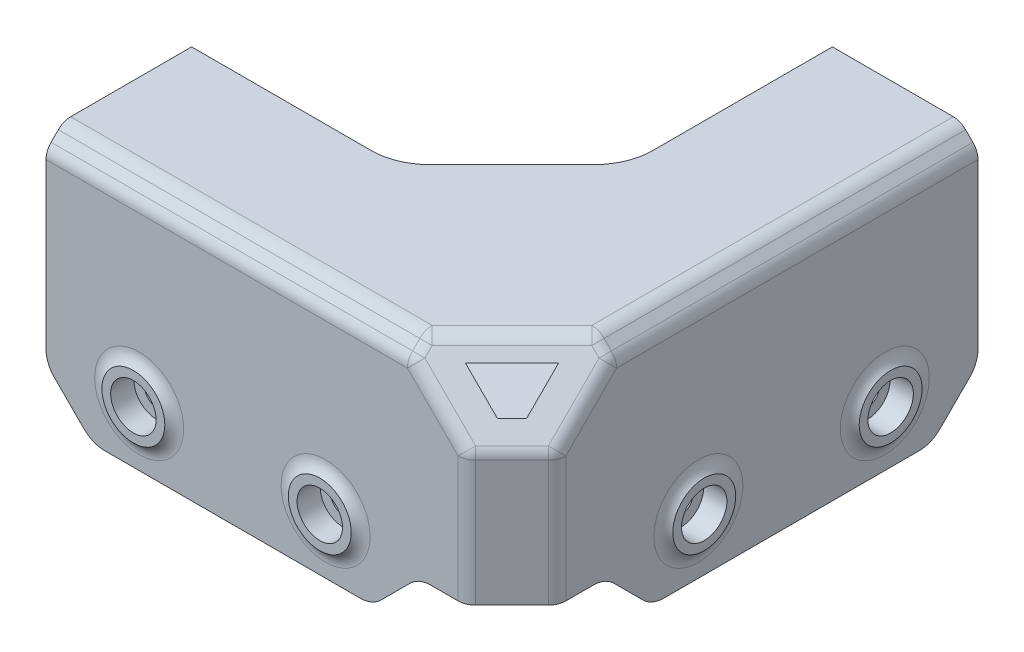
from build123d import *

# Parameters (mm, degrees)
BOSS_EXTRUDE1_DEPTH = 2
BOSS_EXTRUDE2_DEPTH = 20
BOSS_EXTRUDE3_REACH = 101.121
CHAMFER1_SIZE       = 20
FILLET1_R           = 10
SKETCH5_R           = 2.1
CUT_EXTRUDE1_DEPTH  = 100.65565714
SKETCH6_R           = 3.9
CUT_EXTRUDE2_DEPTH  = 3
BOSS_EXTRUDE4_START = 1
SKETCH7_R           = 5.4
SKETCH7_R_2         = 3.9
BOSS_EXTRUDE4_DEPTH = 1
CHAMFER4_SIZE       = 3
CHAMFER6_SIZE       = 8
FILLET4_R           = 3
CHAMFER5_SIZE       = 8
CUT_EXTRUDE3_DEPTH  = 5
FILLET5_R           = 5
SKETCH11_R          = 3.9
CUT_EXTRUDE4_DEPTH  = 3


with BuildPart() as part:
    # Sketch1 → Boss-Extrude1 (new body)
    with BuildSketch(Plane(origin=(0, 0, 0), x_dir=(1, 0, 0), z_dir=(0, 1, 0))):
        Polygon((0, 0), (-55, 0), (-55, -25), (25, -25), (25, 55), (0, 55), align=None)
    extrude(amount=BOSS_EXTRUDE1_DEPTH)

    # Sketch2 → Boss-Extrude2 (add)
    with BuildSketch(Plane.XZ):
        Polygon((-55, 25), (25, 25), (25, -55), (20, -55), (20, 20), (-55, 20), align=None)
    extrude(amount=BOSS_EXTRUDE2_DEPTH)

    # Boss-Extrude3: up to this plane
    boss_extrude3_end = Plane(origin=(0, 0, 0), z_dir=(-0.7071067811865482, 0, 0.7071067811865468))
    # Sketch4 → Boss-Extrude3 (add, up to the surface)
    with BuildSketch(Plane.ZY.offset(55), mode=Mode.PRIVATE) as boss_extrude3_sk1:
        Polygon((25, 2), (25, 22.5), (0, 22.5), (0, 19.5), (20.5, 19.5), (20.5, 14), (0, 14), (0, 5.5), (20.5, 5.5), (20.5, 2), align=None)
    boss_extrude3_tool1 = split(extrude(boss_extrude3_sk1.sketch, amount=-BOSS_EXTRUDE3_REACH, mode=Mode.PRIVATE), bisect_by=boss_extrude3_end, keep=Keep.BOTH, mode=Mode.PRIVATE)
    boss_extrude3 = boss_extrude3_tool1.solids().sort_by_distance((-55, 12.5625, 13.765625))[0]
    add(boss_extrude3)

    # Mirror1: Boss-Extrude3 across plane
    add(boss_extrude3.mirror(Plane(origin=(0, 0, 0), x_dir=(0.7071067811865467, 0, 0.7071067811865482), z_dir=(-0.7071067811865482, 0, 0.7071067811865468))))

    # Chamfer1
    chamfer1_edges = [part.edges().sort_by_distance(p)[0] for p in [
        (0, 1, 0),
        (0, 9.75, 0),
        (0, 21, 0),
    ]]
    chamfer(chamfer1_edges, length=CHAMFER1_SIZE)

    # Fillet1
    fillet1_edges = [part.edges().sort_by_distance(p)[0] for p in [
        (-20, 1, 0),
        (0, 1, -20),
        (0, 9.75, -20),
        (-20, 9.75, 0),
        (0, 21, -20),
        (-20, 21, 0),
    ]]
    fillet(fillet1_edges, radius=FILLET1_R)

    # Sketch5 → Cut-Extrude1 (cut, through all)
    with BuildSketch(Plane.XY.offset(25)):
        with Locations((-39, -10)):
            Circle(SKETCH5_R)
        with Locations((-7, -10)):
            Circle(SKETCH5_R)
    cut_extrude1 = extrude(amount=-CUT_EXTRUDE1_DEPTH, mode=Mode.SUBTRACT)

    # Mirror2: Cut-Extrude1 across plane
    add(cut_extrude1.mirror(Plane(origin=(0, 0, 0), x_dir=(0.7071067811865467, 0, 0.7071067811865482), z_dir=(-0.7071067811865482, 0, 0.7071067811865468))), mode=Mode.SUBTRACT)

    # Sketch6 → Cut-Extrude2 (cut)
    with BuildSketch(Plane.XY.offset(25)):
        with Locations((-39, -10)):
            Circle(SKETCH6_R)
        with Locations((-7, -10)):
            Circle(SKETCH6_R)
    extrude(amount=-CUT_EXTRUDE2_DEPTH, mode=Mode.SUBTRACT)

    # Sketch7 → Boss-Extrude4 (add)
    # profile 1 of 2: a face of its own
    with BuildSketch(Plane.XY.offset(25).offset(BOSS_EXTRUDE4_START)):
        with Locations(Location((-39, -10, 0), (0, 0, 180))):
            Circle(SKETCH7_R)
        with Locations((-39, -10)):
            Circle(SKETCH7_R_2, mode=Mode.SUBTRACT)
    # profile 2 of 2: a face of its own
    with BuildSketch(Plane.XY.offset(25).offset(BOSS_EXTRUDE4_START)):
        with Locations(Location((-7, -10, 0), (0, 0, 180))):
            Circle(SKETCH7_R)
        with Locations((-7, -10)):
            Circle(SKETCH7_R_2, mode=Mode.SUBTRACT)
    boss_extrude4 = extrude(amount=-BOSS_EXTRUDE4_DEPTH)

    # Mirror4: Boss-Extrude4 across plane
    add(boss_extrude4.mirror(Plane(origin=(0, 0, 0), x_dir=(0.7071067811865467, 0, 0.7071067811865482), z_dir=(-0.7071067811865482, 0, 0.7071067811865468))))

    # Sketch8 → Cut-Loft1 section 0
    with BuildSketch(Plane(origin=(0, 22.5, 0), x_dir=(1, 0, 0), z_dir=(0, 1, 0)), mode=Mode.PRIVATE) as cut_loft1_s0:
        with BuildLine():
            Line((5, -25), (25, -5))
            Line((25, -5), (25, -25))
            Line((25, -25), (5, -25))
        make_face()
    loft([Vertex(25, 2.5, 25), cut_loft1_s0.sketch], mode=Mode.SUBTRACT)

    # Chamfer4
    chamfer4_edges = [part.edges().sort_by_distance(p)[0] for p in [
        (25, 22.5, -25),
        (-25, 22.5, 25),
    ]]
    chamfer(chamfer4_edges, length=CHAMFER4_SIZE)

    # Chamfer6
    chamfer6_edges = [part.edges().sort_by_distance(p)[0] for p in [
        (25, -8.75, 25),
    ]]
    chamfer(chamfer6_edges, length=CHAMFER6_SIZE)

    # Fillet4
    # the kernel refuses this fillet: 3 mm, written as the material it adds along each edge
    with BuildSketch(Plane(origin=(-39, -10, 25), x_dir=(-1, 0, 0), z_dir=(0, 1, 0))) as fillet4_piece_1:
        with BuildLine():
            CenterArc((7.636067977, 3), FILLET4_R, 221.810314896, 48.189685104)
            Line((5.4, 1), (5.4, 0))
            Line((5.4, 0), (7.636067977, 0))
        make_face()
    revolve(axis=Axis((-39, -10, 25), (0, 0, 1)))
    with BuildSketch(Plane(origin=(-7, -10, 25), x_dir=(-1, 0, 0), z_dir=(0, 1, 0))) as fillet4_piece_2:
        with BuildLine():
            CenterArc((7.636067977, 3), FILLET4_R, 221.810314896, 48.189685104)
            Line((5.4, 1), (5.4, 0))
            Line((5.4, 0), (7.636067977, 0))
        make_face()
    revolve(axis=Axis((-7, -10, 25), (0, 0, 1)))
    with BuildSketch(Plane(origin=(25, -10, -39), x_dir=(0, 0, -1), z_dir=(0, 1, 0))) as fillet4_piece_3:
        with BuildLine():
            CenterArc((7.636067977, -3), FILLET4_R, 90, 48.189685104)
            Line((5.4, -1), (5.4, 0))
            Line((5.4, 0), (7.636067977, 0))
        make_face()
    revolve(axis=Axis((25, -10, -39), (-1, 0, 0)))
    with BuildSketch(Plane(origin=(25, -10, -7), x_dir=(0, 0, -1), z_dir=(0, 1, 0))) as fillet4_piece_4:
        with BuildLine():
            CenterArc((7.636067977, -3), FILLET4_R, 90, 48.189685104)
            Line((5.4, -1), (5.4, 0))
            Line((5.4, 0), (7.636067977, 0))
        make_face()
    revolve(axis=Axis((25, -10, -7), (-1, 0, 0)))
    # the kernel refuses this fillet: 3 mm, written as the material it takes off along each edge
    with BuildSketch(Plane(origin=(7.046488264, 19.5, 20.757359313), x_dir=(0.4759631494779672, 0.3365567705907776, -0.8125199200687456), z_dir=(0.21513724867401396, 0.8512541359367823, 0.47862549063280946))) as fillet4_2_piece_1_section:
        Polygon((-4.142356801, -4.142356801), (4.142356801, -4.142356801), (4.142356801, 4.142356801), (-4.142356801, 4.142356801), align=None)
    fillet4_2_piece_1 = extrude(amount=4.142356801, mode=Mode.PRIVATE)
    fillet4_2_piece_1 = split(fillet4_2_piece_1, bisect_by=Plane(origin=(7.046488264, 19.5, 20.757359313), z_dir=(-0.7071067811865475, 0, 0.7071067811865476)), keep=Keep.TOP, mode=Mode.PRIVATE)
    fillet4_2_piece_1 = split(fillet4_2_piece_1, bisect_by=Plane(origin=(7.046488264, 19.5, 20.757359313), z_dir=(1, 0, 0)), keep=Keep.TOP, mode=Mode.PRIVATE)
    fillet4_2_piece_1 = split(fillet4_2_piece_1, bisect_by=Plane(origin=(7.046488264, 19.5, 20.757359313), z_dir=(-1.6345182834260301e-15, 0.7071067811865476, -0.7071067811865476)), keep=Keep.TOP, mode=Mode.PRIVATE)
    fillet4_2_piece_1 = split(fillet4_2_piece_1, bisect_by=Plane(origin=(8.813180088, 21.266691824, 22.524051137), z_dir=(-0.5773502691896255, -0.5773502691896266, -0.5773502691896253)), keep=Keep.TOP, mode=Mode.PRIVATE)
    fillet4_2_piece_1 = split(fillet4_2_piece_1, bisect_by=Plane(origin=(7.046488264, 22.56, 20.757359313), z_dir=(0, -1, 0)), keep=Keep.TOP, mode=Mode.PRIVATE)
    fillet4_2_piece_1 = split(fillet4_2_piece_1, bisect_by=Plane(origin=(7.046488264, 21.66374675, 22.921106063), z_dir=(0, -0.7071067811865476, -0.7071067811865476)), keep=Keep.TOP, mode=Mode.PRIVATE)
    fillet4_2_piece_1 = fillet4_2_piece_1 - Plane(origin=(7.046488264, 19.5, 20.757359313), x_dir=(-0.21513724867401396, -0.8512541359367823, -0.47862549063280946), z_dir=(0.4759631494779672, 0.3365567705907776, -0.8125199200687456)) * Sphere(FILLET4_R, mode=Mode.PRIVATE)
    add(fillet4_2_piece_1, mode=Mode.SUBTRACT)
    with BuildSketch(Plane(origin=(20.757359313, 19.5, 7.046488264), x_dir=(0.8125199200687456, -0.3365567705907777, -0.4759631494779674), z_dir=(0.47862549063280957, 0.8512541359367822, 0.2151372486740138))) as fillet4_2_piece_2_section:
        Polygon((-4.142356801, -4.142356801), (4.142356801, -4.142356801), (4.142356801, 4.142356801), (-4.142356801, 4.142356801), align=None)
    fillet4_2_piece_2 = extrude(amount=4.142356801, mode=Mode.PRIVATE)
    fillet4_2_piece_2 = split(fillet4_2_piece_2, bisect_by=Plane(origin=(20.757359313, 19.5, 7.046488264), z_dir=(0.7071067811865475, 0, -0.7071067811865476)), keep=Keep.TOP, mode=Mode.PRIVATE)
    fillet4_2_piece_2 = split(fillet4_2_piece_2, bisect_by=Plane(origin=(20.757359313, 19.5, 7.046488264), z_dir=(0, 0, 1)), keep=Keep.TOP, mode=Mode.PRIVATE)
    fillet4_2_piece_2 = split(fillet4_2_piece_2, bisect_by=Plane(origin=(20.757359313, 19.5, 7.046488264), z_dir=(-0.7071067811865476, 0.7071067811865476, -1.346073880468496e-15)), keep=Keep.TOP, mode=Mode.PRIVATE)
    fillet4_2_piece_2 = split(fillet4_2_piece_2, bisect_by=Plane(origin=(22.524051137, 21.266691824, 8.813180088), z_dir=(-0.5773502691896255, -0.5773502691896266, -0.5773502691896253)), keep=Keep.TOP, mode=Mode.PRIVATE)
    fillet4_2_piece_2 = split(fillet4_2_piece_2, bisect_by=Plane(origin=(20.757359313, 22.56, 7.046488264), z_dir=(0, -1, 0)), keep=Keep.TOP, mode=Mode.PRIVATE)
    fillet4_2_piece_2 = split(fillet4_2_piece_2, bisect_by=Plane(origin=(22.921106063, 21.66374675, 7.046488264), z_dir=(-0.7071067811865476, -0.7071067811865476, 0)), keep=Keep.TOP, mode=Mode.PRIVATE)
    fillet4_2_piece_2 = fillet4_2_piece_2 - Plane(origin=(20.757359313, 19.5, 7.046488264), x_dir=(-0.47862549063280957, -0.8512541359367822, -0.2151372486740138), z_dir=(0.8125199200687456, -0.3365567705907777, -0.4759631494779674)) * Sphere(FILLET4_R, mode=Mode.PRIVATE)
    add(fillet4_2_piece_2, mode=Mode.SUBTRACT)
    with BuildSketch(Plane(origin=(22, 18.257359313, 7.046488264), x_dir=(0, 0.40997761055293136, -0.9120955864630136), z_dir=(0.851254135936782, 0.47862549063280996, 0.21513724867401388))) as fillet4_2_piece_3_section:
        Polygon((-4.142356801, -4.142356801), (4.142356801, -4.142356801), (4.142356801, 4.142356801), (-4.142356801, 4.142356801), align=None)
    fillet4_2_piece_3 = extrude(amount=4.142356801, mode=Mode.PRIVATE)
    fillet4_2_piece_3 = split(fillet4_2_piece_3, bisect_by=Plane(origin=(22, 18.257359313, 7.046488264), z_dir=(0, 0, 1)), keep=Keep.TOP, mode=Mode.PRIVATE)
    fillet4_2_piece_3 = split(fillet4_2_piece_3, bisect_by=Plane(origin=(22, 18.257359313, 7.046488264), z_dir=(0.7071067811865476, -0.7071067811865476, 1.346073880468496e-15)), keep=Keep.TOP, mode=Mode.PRIVATE)
    fillet4_2_piece_3 = split(fillet4_2_piece_3, bisect_by=Plane(origin=(22, 18.257359313, 7.046488264), z_dir=(0, 0.7071067811865468, -0.7071067811865483)), keep=Keep.TOP, mode=Mode.PRIVATE)
    fillet4_2_piece_3 = split(fillet4_2_piece_3, bisect_by=Plane(origin=(25.06, 18.257359313, 7.046488264), z_dir=(-1, 0, 0)), keep=Keep.TOP, mode=Mode.PRIVATE)
    fillet4_2_piece_3 = split(fillet4_2_piece_3, bisect_by=Plane(origin=(24.16374675, 20.421106063, 7.046488264), z_dir=(-0.7071067811865476, -0.7071067811865476, 0)), keep=Keep.TOP, mode=Mode.PRIVATE)
    fillet4_2_piece_3 = split(fillet4_2_piece_3, bisect_by=Plane(origin=(23.766691824, 20.024051137, 8.813180088), z_dir=(-0.5773502691896255, -0.5773502691896266, -0.5773502691896253)), keep=Keep.TOP, mode=Mode.PRIVATE)
    fillet4_2_piece_3 = fillet4_2_piece_3 - Plane(origin=(22, 18.257359313, 7.046488264), x_dir=(-0.851254135936782, -0.47862549063280996, -0.21513724867401388), z_dir=(0, 0.40997761055293136, -0.9120955864630136)) * Sphere(FILLET4_R, mode=Mode.PRIVATE)
    add(fillet4_2_piece_3, mode=Mode.SUBTRACT)
    with BuildSketch(Plane(origin=(7.046488264, 18.257359313, 22), x_dir=(0.9120955864630136, -0.4099776105529315, 0), z_dir=(0.215137248674014, 0.47862549063281007, 0.851254135936782))) as fillet4_2_piece_4_section:
        Polygon((-4.142356801, -4.142356801), (4.142356801, -4.142356801), (4.142356801, 4.142356801), (-4.142356801, 4.142356801), align=None)
    fillet4_2_piece_4 = extrude(amount=4.142356801, mode=Mode.PRIVATE)
    fillet4_2_piece_4 = split(fillet4_2_piece_4, bisect_by=Plane(origin=(7.046488264, 18.257359313, 22), z_dir=(-0.7071067811865482, 0.7071067811865468, 0)), keep=Keep.TOP, mode=Mode.PRIVATE)
    fillet4_2_piece_4 = split(fillet4_2_piece_4, bisect_by=Plane(origin=(7.046488264, 18.257359313, 22), z_dir=(1.6345182834260301e-15, -0.7071067811865476, 0.7071067811865476)), keep=Keep.TOP, mode=Mode.PRIVATE)
    fillet4_2_piece_4 = split(fillet4_2_piece_4, bisect_by=Plane(origin=(7.046488264, 18.257359313, 22), z_dir=(1, 0, 0)), keep=Keep.TOP, mode=Mode.PRIVATE)
    fillet4_2_piece_4 = split(fillet4_2_piece_4, bisect_by=Plane(origin=(7.046488264, 18.257359313, 25.06), z_dir=(0, 0, -1)), keep=Keep.TOP, mode=Mode.PRIVATE)
    fillet4_2_piece_4 = split(fillet4_2_piece_4, bisect_by=Plane(origin=(8.813180088, 20.024051137, 23.766691824), z_dir=(-0.5773502691896255, -0.5773502691896266, -0.5773502691896253)), keep=Keep.TOP, mode=Mode.PRIVATE)
    fillet4_2_piece_4 = split(fillet4_2_piece_4, bisect_by=Plane(origin=(7.046488264, 20.421106063, 24.16374675), z_dir=(0, -0.7071067811865476, -0.7071067811865476)), keep=Keep.TOP, mode=Mode.PRIVATE)
    fillet4_2_piece_4 = fillet4_2_piece_4 - Plane(origin=(7.046488264, 18.257359313, 22), x_dir=(-0.215137248674014, -0.47862549063281007, -0.851254135936782), z_dir=(0.9120955864630136, -0.4099776105529315, 0)) * Sphere(FILLET4_R, mode=Mode.PRIVATE)
    add(fillet4_2_piece_4, mode=Mode.SUBTRACT)
    with BuildSketch(Plane(origin=(22, 9.546488264, 15.757359313), x_dir=(0, 0.9120955864630131, -0.4099776105529326), z_dir=(0.8512541359367822, 0.2151372486740144, 0.47862549063280957))) as fillet4_2_piece_5_section:
        Polygon((-4.142356801, -4.142356801), (4.142356801, -4.142356801), (4.142356801, 4.142356801), (-4.142356801, 4.142356801), align=None)
    fillet4_2_piece_5 = extrude(amount=4.142356801, mode=Mode.PRIVATE)
    fillet4_2_piece_5 = split(fillet4_2_piece_5, bisect_by=Plane(origin=(22, 9.546488264, 15.757359313), z_dir=(0, -0.7071067811865468, 0.7071067811865483)), keep=Keep.TOP, mode=Mode.PRIVATE)
    fillet4_2_piece_5 = split(fillet4_2_piece_5, bisect_by=Plane(origin=(22, 9.546488264, 15.757359313), z_dir=(0.7071067811865476, 0, -0.7071067811865476)), keep=Keep.TOP, mode=Mode.PRIVATE)
    fillet4_2_piece_5 = split(fillet4_2_piece_5, bisect_by=Plane(origin=(22, 9.546488264, 15.757359313), z_dir=(0, 1, 0)), keep=Keep.TOP, mode=Mode.PRIVATE)
    fillet4_2_piece_5 = split(fillet4_2_piece_5, bisect_by=Plane(origin=(25.06, 9.546488264, 15.757359313), z_dir=(-1, 0, 0)), keep=Keep.TOP, mode=Mode.PRIVATE)
    fillet4_2_piece_5 = split(fillet4_2_piece_5, bisect_by=Plane(origin=(23.766691824, 11.313180088, 17.524051137), z_dir=(-0.5773502691896255, -0.5773502691896266, -0.5773502691896253)), keep=Keep.TOP, mode=Mode.PRIVATE)
    fillet4_2_piece_5 = split(fillet4_2_piece_5, bisect_by=Plane(origin=(24.16374675, 9.546488264, 17.921106063), z_dir=(-0.7071067811865476, 0, -0.7071067811865476)), keep=Keep.TOP, mode=Mode.PRIVATE)
    fillet4_2_piece_5 = fillet4_2_piece_5 - Plane(origin=(22, 9.546488264, 15.757359313), x_dir=(-0.8512541359367822, -0.2151372486740144, -0.47862549063280957), z_dir=(0, 0.9120955864630131, -0.4099776105529326)) * Sphere(FILLET4_R, mode=Mode.PRIVATE)
    add(fillet4_2_piece_5, mode=Mode.SUBTRACT)
    with BuildSketch(Plane(origin=(15.757359313, 9.546488264, 22), x_dir=(0.4099776105529324, -0.9120955864630131, 0), z_dir=(0.47862549063280974, 0.2151372486740144, 0.851254135936782))) as fillet4_2_piece_6_section:
        Polygon((-4.142356801, -4.142356801), (4.142356801, -4.142356801), (4.142356801, 4.142356801), (-4.142356801, 4.142356801), align=None)
    fillet4_2_piece_6 = extrude(amount=4.142356801, mode=Mode.PRIVATE)
    fillet4_2_piece_6 = split(fillet4_2_piece_6, bisect_by=Plane(origin=(15.757359313, 9.546488264, 22), z_dir=(0.7071067811865482, -0.7071067811865468, 0)), keep=Keep.TOP, mode=Mode.PRIVATE)
    fillet4_2_piece_6 = split(fillet4_2_piece_6, bisect_by=Plane(origin=(15.757359313, 9.546488264, 22), z_dir=(-0.7071067811865476, 0, 0.7071067811865476)), keep=Keep.TOP, mode=Mode.PRIVATE)
    fillet4_2_piece_6 = split(fillet4_2_piece_6, bisect_by=Plane(origin=(15.757359313, 9.546488264, 22), z_dir=(0, 1, 0)), keep=Keep.TOP, mode=Mode.PRIVATE)
    fillet4_2_piece_6 = split(fillet4_2_piece_6, bisect_by=Plane(origin=(15.757359313, 9.546488264, 25.06), z_dir=(0, 0, -1)), keep=Keep.TOP, mode=Mode.PRIVATE)
    fillet4_2_piece_6 = split(fillet4_2_piece_6, bisect_by=Plane(origin=(17.524051137, 11.313180088, 23.766691824), z_dir=(-0.5773502691896255, -0.5773502691896266, -0.5773502691896253)), keep=Keep.TOP, mode=Mode.PRIVATE)
    fillet4_2_piece_6 = split(fillet4_2_piece_6, bisect_by=Plane(origin=(17.921106063, 9.546488264, 24.16374675), z_dir=(-0.7071067811865476, 0, -0.7071067811865476)), keep=Keep.TOP, mode=Mode.PRIVATE)
    fillet4_2_piece_6 = fillet4_2_piece_6 - Plane(origin=(15.757359313, 9.546488264, 22), x_dir=(-0.47862549063280974, -0.2151372486740144, -0.851254135936782), z_dir=(0.4099776105529324, -0.9120955864630131, 0)) * Sphere(FILLET4_R, mode=Mode.PRIVATE)
    add(fillet4_2_piece_6, mode=Mode.SUBTRACT)
    with BuildSketch(Plane(origin=(8.144564476, 22.5, 21.855435524), x_dir=(0.40824829046386324, -0.8164965809277257, 0.4082482904638636), z_dir=(0.7071067811865476, 0, -0.7071067811865475))) as fillet4_2_piece_7:
        with BuildLine():
            CenterArc((FILLET4_R * 0.517638090205, FILLET4_R), FILLET4_R, 215.264389683, 54.735610317)
            Line((-FILLET4_R * 0.298858490723, FILLET4_R * 0.42264973081), (0, 0))
            Line((0, 0), (FILLET4_R * 0.517638090205, 0))
        make_face()
    extrude(amount=19.390099789, mode=Mode.SUBTRACT)
    with BuildSketch(Plane(origin=(-58.106601718, 22.5, 22), x_dir=(0, -0.7071067811865475, 0.7071067811865475), z_dir=(1, 0, 0)), Plane(origin=(-58.106601718, 19.5, 25), x_dir=(0, -1, 0), z_dir=(1, 0, 0))) as fillet4_2_piece_8:
        with BuildLine():
            CenterArc((FILLET4_R * 0.414213562373, FILLET4_R), FILLET4_R, 225, 45)
            Line((-FILLET4_R * 0.292893218813, FILLET4_R * 0.292893218813), (0, 0))
            Line((0, 0), (FILLET4_R * 0.414213562373, 0))
        make_face()
    extrude(amount=65.153089982, mode=Mode.SUBTRACT)
    with BuildSketch(Plane(origin=(22, 22.5, -58.106601718), x_dir=(0.7071067811865732, -0.7071067811865217, 1.413083212815449e-15), z_dir=(0, 0, 1)), Plane(origin=(25, 19.5, -58.106601718), x_dir=(0, -1, 0), z_dir=(0, 0, 1))) as fillet4_2_piece_9:
        with BuildLine():
            CenterArc((FILLET4_R * 0.414213562373, -FILLET4_R), FILLET4_R, 90, 45)
            Line((-FILLET4_R * 0.292893218813, -FILLET4_R * 0.292893218813), (0, 0))
            Line((0, 0), (FILLET4_R * 0.414213562373, 0))
        make_face()
    extrude(amount=65.153089982, mode=Mode.SUBTRACT)
    with BuildSketch(Plane(origin=(8, 21.621320344, 22.878679656), x_dir=(0.8164965809277264, -0.4082482904638617, -0.4082482904638637), z_dir=(1.6345182834260303e-15, -0.7071067811865476, 0.7071067811865476))) as fillet4_2_piece_10:
        with BuildLine():
            CenterArc((FILLET4_R * 0.317837245196, -FILLET4_R), FILLET4_R, 90, 35.264389683)
            Line((-FILLET4_R * 0.259513023994, -FILLET4_R * 0.183503419072), (0, 0))
            Line((0, 0), (FILLET4_R * 0.317837245196, 0))
        make_face()
    extrude(amount=1.757359313, mode=Mode.SUBTRACT)
    with BuildSketch(Plane(origin=(22.878679656, 21.621320344, 8), x_dir=(-0.4082482904638595, -0.40824829046385785, 0.8164965809277304), z_dir=(0.7071067811865476, -0.7071067811865476, 1.4422220147876744e-15))) as fillet4_2_piece_11:
        with BuildLine():
            CenterArc((FILLET4_R * 0.317837245196, FILLET4_R), FILLET4_R, 234.735610317, 35.264389683)
            Line((-FILLET4_R * 0.259513023994, FILLET4_R * 0.183503419072), (0, 0))
            Line((0, 0), (FILLET4_R * 0.317837245196, 0))
        make_face()
    extrude(amount=1.757359313, mode=Mode.SUBTRACT)
    with BuildSketch(Plane(origin=(25, 10.644564476, 16.855435524), x_dir=(-0.8164965809277264, 0.4082482904638615, 0.4082482904638637), z_dir=(-1.6747652892626796e-15, 0.7071067811865476, -0.7071067811865474)), Plane(origin=(16.855435524, 10.644564476, 25), x_dir=(-0.7071067811865467, -0.7071067811865483, 4.57554386101845e-15), z_dir=(-0.7071067811865483, 0.7071067811865467, 0))) as fillet4_2_piece_12:
        with BuildLine():
            CenterArc((FILLET4_R * 0.517638090205, -FILLET4_R), FILLET4_R, 90, 54.735610317)
            Line((-FILLET4_R * 0.298858490723, -FILLET4_R * 0.42264973081), (0, 0))
            Line((0, 0), (FILLET4_R * 0.517638090205, 0))
        make_face()
    extrude(amount=12.319031977, mode=Mode.SUBTRACT)
    with BuildSketch(Plane(origin=(25, -23.106601718, 17), x_dir=(-0.7071067811865418, 0, 0.7071067811865532), z_dir=(0, 1, 0)), Plane(origin=(17, -23.106601718, 25), x_dir=(-1, 0, 0), z_dir=(0, 1, 0))) as fillet4_2_piece_13:
        with BuildLine():
            CenterArc((FILLET4_R * 0.414213562373, -FILLET4_R), FILLET4_R, 90, 45)
            Line((-FILLET4_R * 0.292893218813, -FILLET4_R * 0.292893218813), (0, 0))
            Line((0, 0), (FILLET4_R * 0.414213562373, 0))
        make_face()
    extrude(amount=32.653089982, mode=Mode.SUBTRACT)
    with BuildSketch(Plane(origin=(17.878679656, 10.5, 24.121320344), x_dir=(-0.4082482904638648, 0.8164965809277243, -0.408248290463865), z_dir=(0.7071067811865476, 0, -0.7071067811865476))) as fillet4_2_piece_14:
        with BuildLine():
            CenterArc((FILLET4_R * 0.317837245196, -FILLET4_R), FILLET4_R, 90, 35.264389683)
            Line((-FILLET4_R * 0.259513023994, -FILLET4_R * 0.183503419072), (0, 0))
            Line((0, 0), (FILLET4_R * 0.317837245196, 0))
        make_face()
    extrude(amount=8.828427125, mode=Mode.SUBTRACT)

    # Chamfer5
    chamfer5_edges = [part.edges().sort_by_distance(p)[0] for p in [
        (-55, -20, 22.5),
        (22.5, -20, -55),
    ]]
    chamfer(chamfer5_edges, length=CHAMFER5_SIZE)

    # Sketch10 → Cut-Extrude3 (cut)
    with BuildSketch(Plane.XY.offset(25)):
        Polygon((1, -20), (9, -12), (25, -12), (25, -20), align=None)
    cut_extrude3 = extrude(amount=-CUT_EXTRUDE3_DEPTH, mode=Mode.SUBTRACT)

    # Mirror5: Cut-Extrude3 across plane
    add(cut_extrude3.mirror(Plane(origin=(0, 0, 0), x_dir=(0.7071067811865467, 0, 0.7071067811865482), z_dir=(-0.7071067811865482, 0, 0.7071067811865468))), mode=Mode.SUBTRACT)

    # Fillet5
    fillet5_edges = [part.edges().sort_by_distance(p)[0] for p in [
        (-47, -20, 22.5),
        (22.5, -20, -47),
        (22.5, -12, -55),
        (-55, -12, 22.5),
        (1, -20, 22.5),
        (9, -12, 22.5),
        (22.5, -20, 1),
        (22.5, -12, 9),
    ]]
    fillet(fillet5_edges, radius=FILLET5_R)

    # Sketch11 → Cut-Extrude4 (cut)
    with BuildSketch(Plane(origin=(25, 0, 0), x_dir=(0, 0, -1), z_dir=(1, 0, 0))):
        with Locations(Location((7, -10, 0), (0, 0, 180))):
            Circle(SKETCH11_R)
        with Locations(Location((39, -10, 0), (0, 0, 180))):
            Circle(SKETCH11_R)
    extrude(amount=-CUT_EXTRUDE4_DEPTH, mode=Mode.SUBTRACT)


solid = part.part
